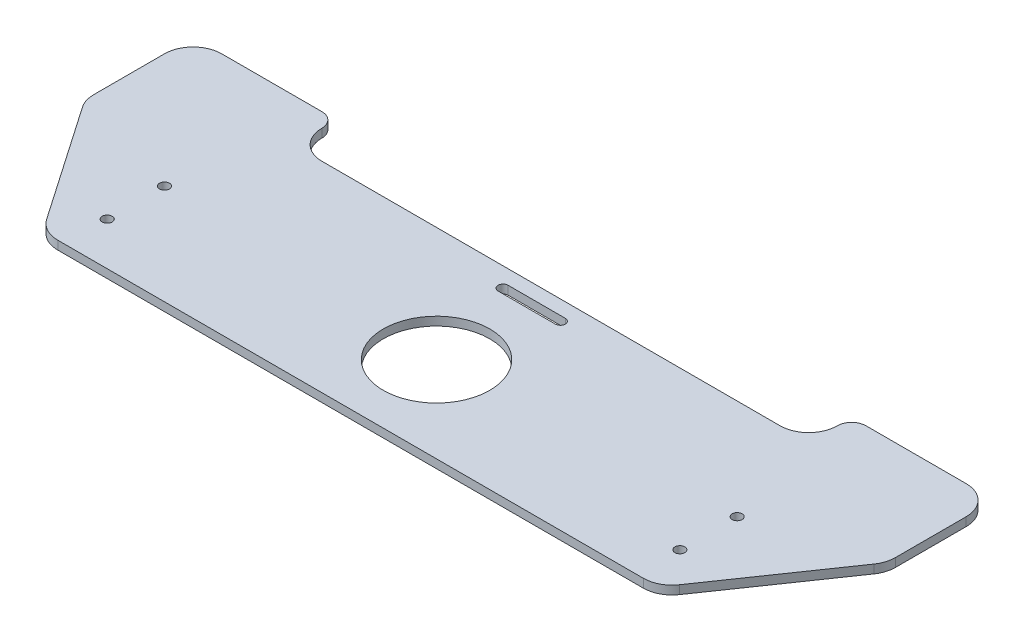
from build123d import *

# Parameters (mm, degrees)
EXTRUDE_1_DEPTH     = 3
SKETCH_4_W          = 287.107775492
SKETCH_4_H          = 19.420897723
CUT_EXTRUDE_2_DEPTH = 18
FILLET_3_R          = 5
FILLET_4_R          = 10
SKETCH_5_R          = 1.75
CUT_EXTRUDE_3_DEPTH = 18
CUT_EXTRUDE_6_DEPTH = 3
SKETCH_9_R          = 18.588109785
CUT_EXTRUDE_7_DEPTH = 10


with BuildPart() as part:
    # 草图1 → 凸台-拉伸1 (new body)
    with BuildSketch(Plane(origin=(0, 0, 0), x_dir=(1, 0, 0), z_dir=(0, 1, 0))):
        with BuildLine():
            Line((-138.235829522, 19.513411872), (-110.492131082, -20.771152042))
            ThreePointArc((-110.492131082, -20.771152042), (-106.908205257, -23.951300285), (-102.25630156, -25.099193643))
            Line((-102.25630156, -25.099193643), (102.25630156, -25.099193643))
            ThreePointArc((102.25630156, -25.099193643), (106.908205257, -23.951300285), (110.492131082, -20.771152042))
            Line((110.492131082, -20.771152042), (138.235829522, 19.513411872))
            ThreePointArc((138.235829522, 19.513411872), (139.548777283, 22.215378286), (140, 25.185370271))
            Line((140, 25.185370271), (140, 65))
            ThreePointArc((140, 65), (137.100120957, 72.000927314), (130.099193643, 74.900806357))
            Line((130.099193643, 74.900806357), (100, 74.900806357))
            ThreePointArc((100, 74.900806357), (92.928932188, 71.971874169), (90, 64.900806357))
            Line((90, 64.900806357), (90, 54.900806357))
            ThreePointArc((90, 54.900806357), (87.071067812, 47.829738545), (80, 44.900806357))
            Line((80, 44.900806357), (-80, 44.900806357))
            ThreePointArc((-80, 44.900806357), (-87.071067812, 47.829738545), (-90, 54.900806357))
            Line((-90, 54.900806357), (-90, 64.900806357))
            ThreePointArc((-90, 64.900806357), (-92.928932188, 71.971874169), (-100, 74.900806357))
            Line((-100, 74.900806357), (-130.099193643, 74.900806357))
            ThreePointArc((-130.099193643, 74.900806357), (-137.100120957, 72.000927314), (-140, 65))
            Line((-140, 65), (-140, 25.185370271))
            ThreePointArc((-140, 25.185370271), (-139.548777283, 22.215378286), (-138.235829522, 19.513411872))
        make_face()
    extrude(amount=EXTRUDE_1_DEPTH)

    # 草图4 → 切除-拉伸2 (cut)
    with BuildSketch(Plane(origin=(0, 3, 0), x_dir=(1, 0, 0), z_dir=(0, 1, 0))):
        with Locations((-3.553887746, 69.611255219)):
            Rectangle(SKETCH_4_W, SKETCH_4_H)
    extrude(amount=-CUT_EXTRUDE_2_DEPTH, mode=Mode.SUBTRACT)

    # 圆角3
    fillet_3_edges = [part.edges().sort_by_distance(p)[0] for p in [
        (-90, 1.5, -59.900806357),
        (90, 1.5, -59.900806357),
    ]]
    fillet(fillet_3_edges, radius=FILLET_3_R - 0.0001)  # a hair under: the kernel refuses the full size

    # 圆角4
    fillet_4_edges = [part.edges().sort_by_distance(p)[0] for p in [
        (140, 1.5, -59.900806357),
        (-140, 1.5, -59.900806357),
    ]]
    fillet(fillet_4_edges, radius=FILLET_4_R)

    # 草图5 → 切除-拉伸3 (cut)
    with BuildSketch(Plane(origin=(0, 3, 0), x_dir=(1, 0, 0), z_dir=(0, 1, 0))):
        with Locations(Location((100, -10.099193643, 0), (0, 0, 270))):
            Circle(SKETCH_5_R)
        with Locations(Location((100, 9.900806357, 0), (0, 0, 270))):
            Circle(SKETCH_5_R)
        with Locations(Location((-100, -10.099193643, 0), (0, 0, 270))):
            Circle(SKETCH_5_R)
        with Locations(Location((-100, 9.900806357, 0), (0, 0, 270))):
            Circle(SKETCH_5_R)
    extrude(amount=-CUT_EXTRUDE_3_DEPTH, mode=Mode.SUBTRACT)

    # 草图8 → 切除-拉伸6 (cut)
    with BuildSketch(Plane(origin=(0, 3, 0), x_dir=(1, 0, 0), z_dir=(0, 1, 0))):
        with BuildLine():
            Line((-10, 39.900806357), (10, 39.900806357))
            ThreePointArc((10, 39.900806357), (11.75, 38.150806357), (10, 36.400806357))
            Line((10, 36.400806357), (-10, 36.400806357))
            ThreePointArc((-10, 36.400806357), (-11.75, 38.150806357), (-10, 39.900806357))
        make_face()
    extrude(amount=-CUT_EXTRUDE_6_DEPTH, mode=Mode.SUBTRACT)

    # 草图9 → 切除-拉伸7 (cut)
    with BuildSketch(Plane.XZ):
        with Locations(Location((0, -4.911890215, 0), (0, 0, 270))):
            Circle(SKETCH_9_R)
    extrude(amount=-CUT_EXTRUDE_7_DEPTH, mode=Mode.SUBTRACT)


solid = part.part
